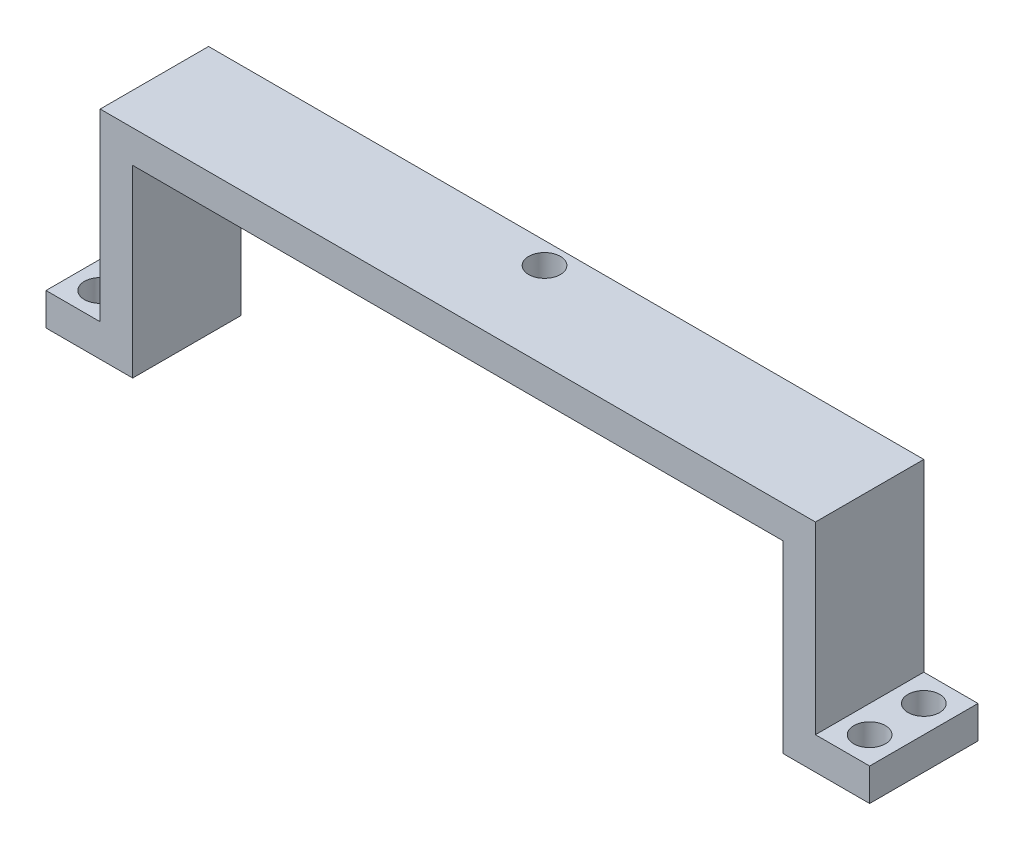
from build123d import *

# Parameters (mm, degrees)
SKETCH1_W           = 66
SKETCH1_H           = 10
BOSS_EXTRUDE1_DEPTH = 3
SKETCH3_W           = 3
SKETCH3_H           = 10
BOSS_EXTRUDE2_DEPTH = 14
SKETCH4_W           = 8
SKETCH4_H           = 10
BOSS_EXTRUDE3_DEPTH = 3
SKETCH5_R           = 1.46
CUT_EXTRUDE1_DEPTH  = 44.231932642
SKETCH6_R           = 1.46
CUT_EXTRUDE2_DEPTH  = 42.928510586


with BuildPart() as part:
    # Sketch1 → Boss-Extrude1 (new body)
    with BuildSketch(Plane(origin=(0, 0, 0), x_dir=(1, 0, 0), z_dir=(0, 1, 0))):
        Rectangle(SKETCH1_W, SKETCH1_H)
    extrude(amount=BOSS_EXTRUDE1_DEPTH)

    # Sketch3 → Boss-Extrude2 (add)
    with BuildSketch(Plane.XZ):
        with Locations((-31.5, 0)):
            Rectangle(SKETCH3_W, SKETCH3_H)
        with Locations((31.5, 0)):
            Rectangle(SKETCH3_W, SKETCH3_H)
    extrude(amount=BOSS_EXTRUDE2_DEPTH)

    # Sketch4 → Boss-Extrude3 (add)
    with BuildSketch(Plane.XZ.offset(14)):
        with Locations((-34, 0)):
            Rectangle(SKETCH4_W, SKETCH4_H)
        with Locations((34, 0)):
            Rectangle(SKETCH4_W, SKETCH4_H)
    extrude(amount=BOSS_EXTRUDE3_DEPTH)

    # Sketch5 → Cut-Extrude1 (cut, through all)
    with BuildSketch(Plane(origin=(0, 3, 0), x_dir=(1, 0, 0), z_dir=(0, 1, 0))):
        with Locations((0, 3)):
            Circle(SKETCH5_R)
    extrude(amount=-CUT_EXTRUDE1_DEPTH, mode=Mode.SUBTRACT)

    # Sketch6 → Cut-Extrude2 (cut, through all)
    with BuildSketch(Plane(origin=(0, -14, 0), x_dir=(1, 0, 0), z_dir=(0, 1, 0))):
        with Locations((-35.5, -2.5)):
            Circle(SKETCH6_R)
        with Locations((-35.5, 2.5)):
            Circle(SKETCH6_R)
    cut_extrude2 = extrude(amount=-CUT_EXTRUDE2_DEPTH, mode=Mode.SUBTRACT)

    # Mirror1: Cut-Extrude2 across plane
    add(cut_extrude2.mirror(Plane(origin=(0, 0, 0), x_dir=(0, 0, 1), z_dir=(1, 0, 0))), mode=Mode.SUBTRACT)


solid = part.part
